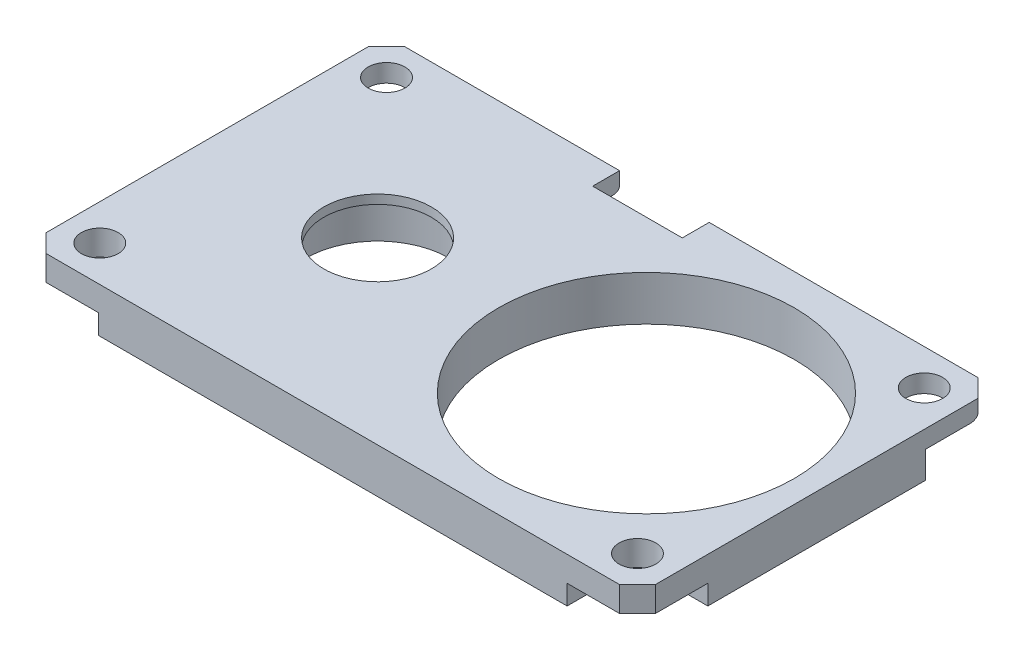
from build123d import *
from build123d.topology import SkipClean

# Parameters (mm, degrees)
SKETCH1_W                = 34
SKETCH1_H                = 20
BOSS_EXTRUDE1_DEPTH      = 2.5
SKETCH2_R                = 3
SKETCH2_R_2              = 8.25
CUT_EXTRUDE1_DEPTH       = 5
SKETCH5_R                = 4.025
CUT_EXTRUDE4_DEPTH       = 2
SKETCH3_R                = 1.025
CUT_EXTRUDE2_DEPTH       = 4
SKETCH4_R                = 1.925
CUT_EXTRUDE3_DEPTH       = 1.5
CUT_EXTRUDE5_DEPTH       = 1.5
FILLET1_R                = 2
CHAMFER1_SIZE            = 1
FILLET2_R                = 0.3
FILLET1_OF_MIRROR1_R     = 2
CHAMFER1_OF_MIRROR1_SIZE = 1
FILLET2_OF_MIRROR1_R     = 0.3
SKETCH7_W                = 34
SKETCH7_H                = 2.5
CUT_EXTRUDE6_DEPTH       = 50
SKETCH8_W                = 5
SKETCH8_H                = 1.5
CUT_EXTRUDE7_DEPTH       = 50
BOSS_EXTRUDE2_START      = 0.5
SKETCH9_R                = 5.525
SKETCH9_R_2              = 4.025
BOSS_EXTRUDE2_DEPTH      = 0.5
CUT_EXTRUDE8_DEPTH       = 1.5
BOSS_EXTRUDE3_START      = 0.4
SKETCH11_R               = 1.025
BOSS_EXTRUDE3_DEPTH      = 0.4


with BuildPart() as part:
    # Sketch1 → Boss-Extrude1 (new body)
    with BuildSketch(Plane(origin=(0, 0, 0), x_dir=(1, 0, 0), z_dir=(0, 1, 0))):
        Rectangle(SKETCH1_W, SKETCH1_H)
    boss_extrude1 = extrude(amount=BOSS_EXTRUDE1_DEPTH)

    # Sketch2 → Cut-Extrude1 (cut)
    with BuildSketch(Plane(origin=(0, 2.5, 0), x_dir=(1, 0, 0), z_dir=(0, 1, 0))):
        with Locations(Location((-7.5, 0, 0), (0, 0, 270))):
            Circle(SKETCH2_R)
        with Locations(Location((7.5, 0, 0), (0, 0, 270))):
            Circle(SKETCH2_R_2)
    cut_extrude1 = extrude(amount=-CUT_EXTRUDE1_DEPTH, mode=Mode.SUBTRACT)

    # Sketch5 → Cut-Extrude4 (cut)
    with BuildSketch(Plane(origin=(0, 2.5, 0), x_dir=(1, 0, 0), z_dir=(0, 1, 0))):
        with Locations(Location((-7.5, 0, 0), (0, 0, 270))):
            Circle(SKETCH5_R)
    cut_extrude4 = extrude(amount=-CUT_EXTRUDE4_DEPTH, mode=Mode.SUBTRACT)

    # Sketch3 → Cut-Extrude2 (cut)
    with BuildSketch(Plane(origin=(0, 2.5, 0), x_dir=(1, 0, 0), z_dir=(0, 1, 0))):
        with Locations(Location((15, 8, 0), (0, 0, 270))):
            Circle(SKETCH3_R)
        with Locations(Location((-15, 8, 0), (0, 0, 270))):
            Circle(SKETCH3_R)
        with Locations(Location((-15, -8, 0), (0, 0, 270))):
            Circle(SKETCH3_R)
        with Locations(Location((15, -8, 0), (0, 0, 270))):
            Circle(SKETCH3_R)
    cut_extrude2 = extrude(amount=-CUT_EXTRUDE2_DEPTH, mode=Mode.SUBTRACT)

    # Sketch4 → Cut-Extrude3 (cut)
    with BuildSketch(Plane(origin=(0, 2.5, 0), x_dir=(1, 0, 0), z_dir=(0, 1, 0))):
        with Locations(Location((-15, 8, 0), (0, 0, 270))):
            Circle(SKETCH4_R)
        with Locations(Location((-15, -8, 0), (0, 0, 270))):
            Circle(SKETCH4_R)
        with Locations(Location((15, 8, 0), (0, 0, 270))):
            Circle(SKETCH4_R)
        with Locations(Location((15, -8, 0), (0, 0, 270))):
            Circle(SKETCH4_R)
    cut_extrude3 = extrude(amount=-CUT_EXTRUDE3_DEPTH, mode=Mode.SUBTRACT)

    # Sketch6 → Cut-Extrude5 (cut)
    with BuildSketch(Plane(origin=(0, 2.5, 0), x_dir=(1, 0, 0), z_dir=(0, 1, 0))):
        with BuildLine():
            Line((17, 10), (-17, 10))
            Line((-17, 10), (-17, 6.075))
            Line((-17, 6.075), (-15, 6.075))
            ThreePointArc((-15, 6.075), (-13.472236111, 6.828862732), (-13.141068855, 8.5))
            Line((-13.141068855, 8.5), (13.141068855, 8.5))
            ThreePointArc((13.141068855, 8.5), (13.472236111, 6.828862732), (15, 6.075))
            Line((15, 6.075), (17, 6.075))
            Line((17, 6.075), (17, 10))
        make_face()
    cut_extrude5 = extrude(amount=-CUT_EXTRUDE5_DEPTH, mode=Mode.SUBTRACT)

    # Fillet1
    fillet1_edges = [part.edges().sort_by_distance(p)[0] for p in [
        (13.141068855, 1.75, -8.5),
        (-13.141068855, 1.75, -8.5),
    ]]
    fillet(fillet1_edges, radius=FILLET1_R)

    # Chamfer1
    chamfer1_edges = [part.edges().sort_by_distance(p)[0] for p in [
        (17, 1.25, 10),
        (-17, 1.25, 10),
        (-17, 0.5, -10),
        (17, 0.5, -10),
    ]]
    chamfer(chamfer1_edges, length=CHAMFER1_SIZE)

    # Fillet2
    fillet2_edges = [part.edges().sort_by_distance(p)[0] for p in [
        (0, 1, -10),
        (16.5, 1, -9.5),
        (-16.5, 1, -9.5),
    ]]
    fillet(fillet2_edges, radius=FILLET2_R)


with BuildPart() as mirror1_1:
    # Mirror1: Boss-Extrude1 across plane
    add(boss_extrude1.mirror(Plane.ZX))

    # Mirror1 2: Cut-Extrude1, Cut-Extrude4, Cut-Extrude2, Cut-Extrude3, Cut-Extrude5 across plane
    add(cut_extrude1.mirror(Plane.ZX), mode=Mode.SUBTRACT)
    add(cut_extrude4.mirror(Plane.ZX), mode=Mode.SUBTRACT)
    add(cut_extrude2.mirror(Plane.ZX), mode=Mode.SUBTRACT)
    add(cut_extrude3.mirror(Plane.ZX), mode=Mode.SUBTRACT)
    add(cut_extrude5.mirror(Plane.ZX), mode=Mode.SUBTRACT)

    # Fillet1 of Mirror1
    fillet1_of_mirror1_edges = [mirror1_1.edges().sort_by_distance(p)[0] for p in [
        (13.141068855, -1.75, -8.5),
        (-13.141068855, -1.75, -8.5),
    ]]
    fillet(fillet1_of_mirror1_edges, radius=FILLET1_OF_MIRROR1_R)

    # Chamfer1 of Mirror1
    chamfer1_of_mirror1_edges = [mirror1_1.edges().sort_by_distance(p)[0] for p in [
        (17, -1.25, 10),
        (-17, -1.25, 10),
        (-17, -0.5, -10),
        (17, -0.5, -10),
    ]]
    chamfer(chamfer1_of_mirror1_edges, length=CHAMFER1_OF_MIRROR1_SIZE)

    # Fillet2 of Mirror1
    fillet2_of_mirror1_edges = [mirror1_1.edges().sort_by_distance(p)[0] for p in [
        (0, -1, -10),
        (16.5, -1, -9.5),
        (-16.5, -1, -9.5),
    ]]
    fillet(fillet2_of_mirror1_edges, radius=FILLET2_OF_MIRROR1_R)


with BuildPart() as part_1:
    add(part.part)

    # Mirror1 united with what the copies touc: union Mirror1_1
    add(mirror1_1.part)

    # Sketch7 → Cut-Extrude6 (cut)
    with BuildSketch(Plane.XY.offset(10)):
        with Locations((0, 1.25)):
            Rectangle(SKETCH7_W, SKETCH7_H)
    extrude(amount=-CUT_EXTRUDE6_DEPTH, mode=Mode.SUBTRACT)

    # Sketch8 → Cut-Extrude7 (cut)
    with BuildSketch(Plane.XZ.offset(1)):
        with Locations((-1.5, -9.25)):
            Rectangle(SKETCH8_W, SKETCH8_H)
    extrude(amount=-CUT_EXTRUDE7_DEPTH, mode=Mode.SUBTRACT)

    # Sketch9 → Boss-Extrude2 (add)
    with SkipClean():  # the faces are left unmerged after this step: merging them gives an invalid solid
        with BuildSketch(Plane.XZ.offset(2.5).offset(BOSS_EXTRUDE2_START)):
            with Locations(Location((-7.5, 0, 0), (0, 0, 270))):
                Circle(SKETCH9_R)
            with Locations(Location((-7.5, 0, 0), (0, 0, 270))):
                Circle(SKETCH9_R_2, mode=Mode.SUBTRACT)
        extrude(amount=-BOSS_EXTRUDE2_DEPTH)

    # Sketch10 → Cut-Extrude8 (cut)
    with BuildSketch(Plane.XZ.offset(2.5)):
        with BuildLine():
            Line((-15, 6.075), (-17, 6.075))
            Line((-17, 6.075), (-17, 9))
            Line((-17, 9), (-16, 10))
            Line((-16, 10), (-13.075, 10))
            Line((-13.075, 10), (-13.075, 8))
            ThreePointArc((-13.075, 8), (-16.361180554, 9.361180554), (-15, 6.075))
        make_face()
        with BuildLine():
            Line((13.075, 10), (13.075, 8))
            ThreePointArc((13.075, 8), (16.361180554, 9.361180554), (15, 6.075))
            Line((15, 6.075), (17, 6.075))
            Line((17, 6.075), (17, 9))
            Line((17, 9), (16, 10))
            Line((16, 10), (13.075, 10))
        make_face()
    extrude(amount=-CUT_EXTRUDE8_DEPTH, mode=Mode.SUBTRACT)

    # Sketch11 → Boss-Extrude3 (add)
    # profile 1 of 2: a face of its own
    with SkipClean():  # the faces are left unmerged after this step: merging them gives an invalid solid
        with BuildSketch(Plane.XZ.offset(1).offset(BOSS_EXTRUDE3_START)):
            with BuildLine():
                Line((-13.075, 8), (-13.075, 10))
                Line((-13.075, 10), (-16, 10))
                Line((-16, 10), (-17, 9))
                Line((-17, 9), (-17, 6.075))
                Line((-17, 6.075), (-15, 6.075))
                ThreePointArc((-15, 6.075), (-13.638819446, 6.638819446), (-13.075, 8))
            make_face()
            with Locations(Location((-15, 8, 0), (0, 0, 270))):
                Circle(SKETCH11_R, mode=Mode.SUBTRACT)
        # profile 2 of 2: a face of its own
        with BuildSketch(Plane.XZ.offset(1).offset(BOSS_EXTRUDE3_START)):
            with BuildLine():
                Line((15, 6.075), (17, 6.075))
                Line((17, 6.075), (17, 9))
                Line((17, 9), (16, 10))
                Line((16, 10), (13.075, 10))
                Line((13.075, 10), (13.075, 8))
                ThreePointArc((13.075, 8), (13.638819446, 6.638819446), (15, 6.075))
            make_face()
            with Locations(Location((15, 8, 0), (0, 0, 270))):
                Circle(SKETCH11_R, mode=Mode.SUBTRACT)
        extrude(amount=-BOSS_EXTRUDE3_DEPTH)


solid = part_1.part
